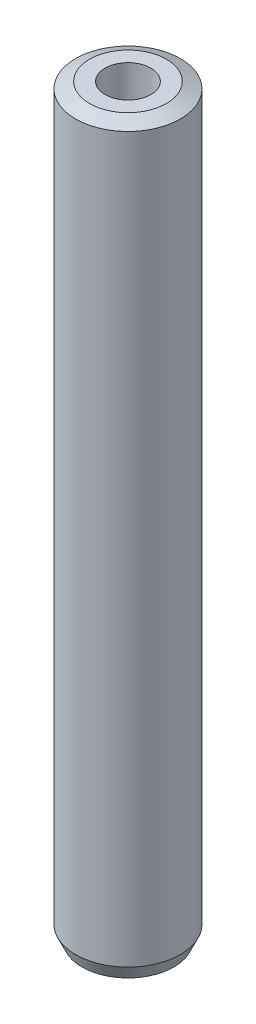
from build123d import *
from OCP.BRepFilletAPI import BRepFilletAPI_MakeChamfer

# Parameters (mm, degrees)
SKETCH1_R           = 40
BOSS_EXTRUDE1_DEPTH = 568.272869743
SKETCH2_R           = 17.508939741
CUT_EXTRUDE1_DEPTH  = 572.081477975
CHAMFER1_SIZE       = 4.891814176
CHAMFER1_SIZE2      = 10.656033474


with BuildPart() as part:
    # Sketch1 → Boss-Extrude1 (new body)
    with BuildSketch(Plane(origin=(0, 0, 0), x_dir=(1, 0, 0), z_dir=(0, 1, 0))):
        Circle(SKETCH1_R)
    extrude(amount=BOSS_EXTRUDE1_DEPTH)

    # Sketch2 → Cut-Extrude1 (cut, through all)
    with BuildSketch(Plane(origin=(0, 0, 0), x_dir=(1, 0, 0), z_dir=(0, 1, 0))):
        Circle(SKETCH2_R)
    extrude(amount=CUT_EXTRUDE1_DEPTH, mode=Mode.SUBTRACT)

    # Chamfer1: one chamfer whose edges measure the first distance from different faces: ONE call of the kernel's chamfer builder (chamfer() names one face for all edges)
    chamfer1_edges_1 = [part.edges().sort_by_distance(p)[0] for p in [
        (-40, 568.272869743, 0),
    ]]
    chamfer1_side_1 = [part.faces().sort_by_distance(p)[0] for p in [
        (-40, 284.136434871, 0),
    ]]
    chamfer1_edges_2 = [part.edges().sort_by_distance(p)[0] for p in [
        (-40, 0, 0),
    ]]
    chamfer1_side_2 = [part.faces().sort_by_distance(p)[0] for p in [
        (-38.86862915, 0, 0),
    ]]
    chamfer1 = BRepFilletAPI_MakeChamfer(part.part.solid().wrapped)
    for e in chamfer1_edges_1:
        chamfer1.Add(CHAMFER1_SIZE, CHAMFER1_SIZE2, e.wrapped, chamfer1_side_1[0].wrapped)  # the first distance lies on this face
    for e in chamfer1_edges_2:
        chamfer1.Add(CHAMFER1_SIZE, CHAMFER1_SIZE2, e.wrapped, chamfer1_side_2[0].wrapped)  # the first distance lies on this face
    add(Compound.cast(chamfer1.Shape()), mode=Mode.REPLACE)


solid = part.part
